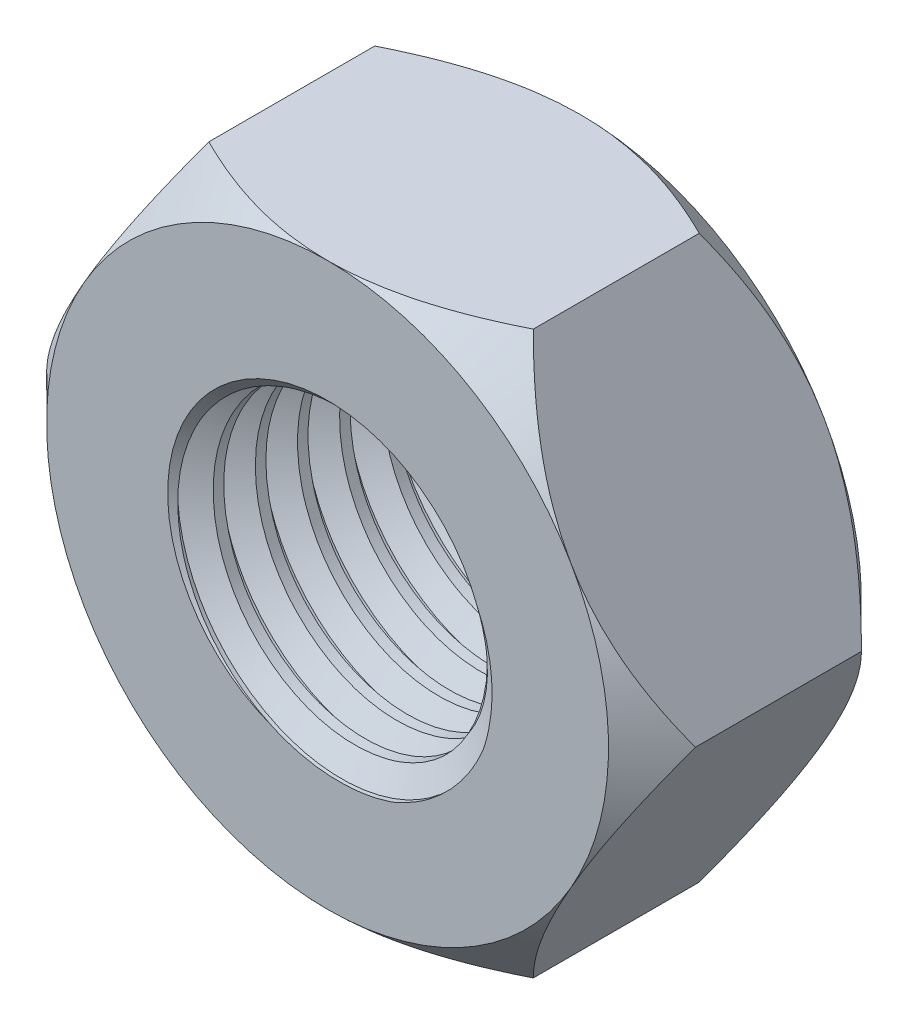
from build123d import *

# Parameters (mm, degrees)
BOSS_EXTRUDE1_DEPTH     = 4.5
SKETCH2_OUTSIDE_W       = 68.922
SKETCH2_OUTSIDE_H       = 65.828
SKETCH2_OUTSIDE_R       = 10
CUT_EXTRUDE2_DEPTH      = 18.729448196
CUT_EXTRUDE2_DRAFT      = -45
MIRROR1_COPY_1_SKETCH_W = 68.922
MIRROR1_COPY_1_SKETCH_H = 65.828
MIRROR1_COPY_1_SKETCH_R = 10
MIRROR1_COPY_1_DEPTH    = 18.729448196
MIRROR1_COPY_1_DRAFT    = -45
SKETCH4_R               = 5.19
CUT_EXTRUDE3_DEPTH      = 18.729448196
CHAMFER1_SIZE           = 0.5
THREAD1_PITCH           = 1.5


with BuildPart() as part:
    # Sketch1 → Boss-Extrude1 (new, symmetric)
    with BuildSketch(Plane.XY):
        Polygon((5.773502692, -10), (11.547005384, 0), (5.773502692, 10), (-5.773502692, 10), (-11.547005384, 0), (-5.773502692, -10), align=None)
    extrude(amount=BOSS_EXTRUDE1_DEPTH, both=True)


with BuildPart() as cut_extrude2_tool:
    # Sketch2 outside → Cut-Extrude2 (with draft: the straight prism first)
    with BuildSketch(Plane.XY.offset(4.5)):
        Rectangle(SKETCH2_OUTSIDE_W, SKETCH2_OUTSIDE_H)
        Circle(SKETCH2_OUTSIDE_R, mode=Mode.SUBTRACT)
    extrude(amount=-CUT_EXTRUDE2_DEPTH)
    # Cut-Extrude2: the draft: its side faces are tilted about the plane it starts from
    cut_extrude2_sides = [cut_extrude2_tool.faces().sort_by_distance(p)[0] for p in [
        (0, -32.914, -4.864724098),
        (34.461, 0, -4.864724098),
        (0, 32.914, -4.864724098),
        (-34.461, 0, -4.864724098),
        (-10, 0, -4.864724098),
    ]]
    draft(cut_extrude2_sides, Plane.XY.offset(4.5), CUT_EXTRUDE2_DRAFT)


with BuildPart() as part_1:
    add(part.part)

    # Cut-Extrude2: cut by cut_extrude2_tool
    add(cut_extrude2_tool.part, mode=Mode.SUBTRACT)


with BuildPart() as mirror1_copy_1_tool:
    # Mirror1 copy 1 sketch → Mirror1 copy 1 (with draft: the straight prism first)
    with BuildSketch(Plane(origin=(0, 0, -4.5), x_dir=(1, 0, 0), z_dir=(0, 0, -1))):
        Rectangle(MIRROR1_COPY_1_SKETCH_W, MIRROR1_COPY_1_SKETCH_H)
        Circle(MIRROR1_COPY_1_SKETCH_R, mode=Mode.SUBTRACT)
    extrude(amount=-MIRROR1_COPY_1_DEPTH)
    # Mirror1 copy 1: the draft: its side faces are tilted about the plane it starts from
    mirror1_copy_1_sides = [mirror1_copy_1_tool.faces().sort_by_distance(p)[0] for p in [
        (0, -32.914, 4.864724098),
        (34.461, 0, 4.864724098),
        (0, 32.914, 4.864724098),
        (-34.461, 0, 4.864724098),
        (-10, 0, 4.864724098),
    ]]
    draft(mirror1_copy_1_sides, Plane(origin=(0, 0, -4.5), x_dir=(1, 0, 0), z_dir=(0, 0, -1)), MIRROR1_COPY_1_DRAFT)


with BuildPart() as part_2:
    add(part_1.part)

    # Mirror1 copy 1: cut by mirror1_copy_1_tool
    add(mirror1_copy_1_tool.part, mode=Mode.SUBTRACT)

    # Sketch4 → Cut-Extrude3 (cut, through all)
    with BuildSketch(Plane.XY.offset(4.5)):
        Circle(SKETCH4_R)
    extrude(amount=-CUT_EXTRUDE3_DEPTH, mode=Mode.SUBTRACT)

    # Chamfer1
    chamfer1_edges = [part_2.edges().sort_by_distance(p)[0] for p in [
        (-5.19, 0, 4.5),
    ]]
    chamfer(chamfer1_edges, length=CHAMFER1_SIZE)

    # Thread1: the profile of Thread Profile1 profile screwed along a right-hand helix of 7 turns, 8 arcs to a turn; built about Z, then put on its axis
    thread1_z = Axis((0, 0, 0), (0, 0, 1))
    thread1_corners = [(5.1897, 0, -0.000173205), (6.001898813, 0, 0.468749998), (6.001898813, 0, 0.656249998), (5.1897, 0, 1.125173201)]
    with BuildLine(mode=Mode.PRIVATE) as thread1_profile:
        Line(thread1_corners[0], thread1_corners[1])
        Line(thread1_corners[1], thread1_corners[2])
        Line(thread1_corners[2], thread1_corners[3])
        Line(thread1_corners[3], thread1_corners[0])
    thread1_cap = Face(thread1_profile.wire())
    thread1_turn_angles = [0, 22.5, 45, 67.5, 90, 112.5, 135, 157.5, 180, 202.5, 225, 247.5, 270, 292.5, 315, 337.5, 360]
    thread1_turn_weights = [1, 0.9238795325112867, 1, 0.9238795325112867, 1, 0.9238795325112867, 1, 0.9238795325112867, 1, 0.9238795325112867, 1, 0.9238795325112867, 1, 0.9238795325112867, 1, 0.9238795325112867, 1]
    thread1_turn_rails = [Edge.make_bspline([Vector(p[0], p[1], 0).rotate(thread1_z, thread1_turn_angles[k]) / thread1_turn_weights[k] + Vector(0, 0, p[2] + THREAD1_PITCH * thread1_turn_angles[k] / 360) for k in range(17)], [0, 0, 0, 1, 1, 2, 2, 3, 3, 4, 4, 5, 5, 6, 6, 7, 7, 8, 8, 8], 2, thread1_turn_weights) for p in thread1_corners]
    thread1_turn_sides = [Face.make_surface_from_curves(thread1_turn_rails[p[0]], thread1_turn_rails[p[1]]) for p in [(0, 1), (1, 2), (2, 3), (3, 0)]]
    thread1 = Plane(origin=(0, 0, 6), x_dir=(-1, 0, 0), z_dir=(0, 0, -1)) * Solid(Shell([*[p.moved(Location((0, 0, THREAD1_PITCH * i))) for i in range(7) for p in thread1_turn_sides], thread1_cap, thread1_cap.rotate(thread1_z, 2520).moved(Location((0, 0, THREAD1_PITCH * 2520 / 360)))]))
    add(thread1, mode=Mode.SUBTRACT)


solid = part_2.part
